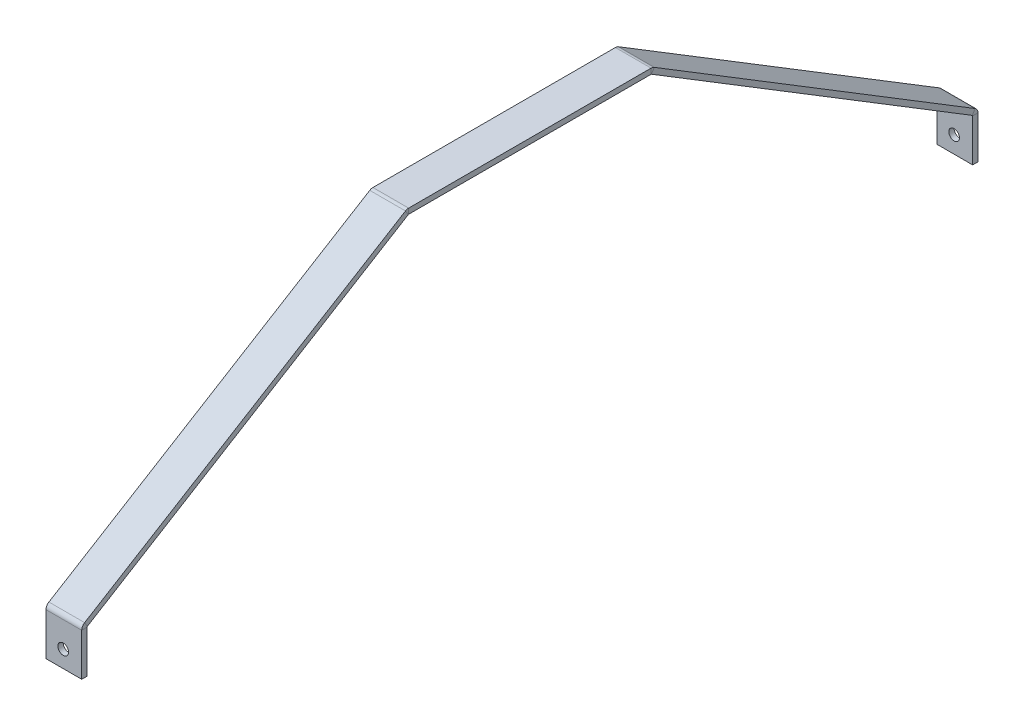
from build123d import *

# Parameters (mm, degrees)
SM_BASE_FLANGE_1_DEPTH = 10
SKETCH_6_R             = 1.5
CUT_EXTRUDE_1_DEPTH    = 260.98076852


# Sheet-metal steps are written as plain solids
with BuildPart() as part:
    # Sketch 1 → 基体-法兰1 (new body)
    with BuildSketch(Plane(origin=(0, 0, 0), x_dir=(0, 0, -1), z_dir=(1, 0, 0))):
        with BuildLine():
            Line((124, -67), (124, -55.112166923))
            ThreePointArc((124, -55.112166923), (123.974439102, -55.014335437), (123.904290002, -54.941510557))
            Line((123.904290002, -54.941510557), (34.048016854, -0.029343633))
            ThreePointArc((34.048016854, -0.029343633), (33.997896617, -0.007475621), (33.943726853, 0))
            Line((33.943726853, 0), (-33.943726853, 0))
            ThreePointArc((-33.943726853, 0), (-33.997896617, -0.007475621), (-34.048016854, -0.029343633))
            Line((-34.048016854, -0.029343633), (-123.904290002, -54.941510557))
            ThreePointArc((-123.904290002, -54.941510557), (-123.974439102, -55.014335437), (-124, -55.112166923))
            Line((-124, -55.112166923), (-124, -67))
            Line((-124, -67), (-125.5, -67))
            Line((-125.5, -67), (-125.5, -55.112166923))
            ThreePointArc((-125.5, -55.112166923), (-125.282732364, -54.280599285), (-124.686465016, -53.661587806))
            Line((-124.686465016, -53.661587806), (-34.830191869, 1.250579117))
            ThreePointArc((-34.830191869, 1.250579117), (-34.404169846, 1.436457225), (-33.943726853, 1.5))
            Line((-33.943726853, 1.5), (33.943726853, 1.5))
            ThreePointArc((33.943726853, 1.5), (34.404169846, 1.436457225), (34.830191869, 1.250579117))
            Line((34.830191869, 1.250579117), (124.686465016, -53.661587806))
            ThreePointArc((124.686465016, -53.661587806), (125.282732364, -54.280599286), (125.5, -55.112166924))
            Line((125.5, -55.112166923), (125.5, -67))
            Line((125.5, -67), (124, -67))
        make_face()
    extrude(amount=SM_BASE_FLANGE_1_DEPTH)

    # 草图6 → 切除-拉伸1 (cut, through all)
    with BuildSketch(Plane.XY.offset(125.5)):
        with Locations((4.823171357, -62.280383367)):
            Circle(SKETCH_6_R)
    extrude(amount=-CUT_EXTRUDE_1_DEPTH, mode=Mode.SUBTRACT)


solid = part.part
